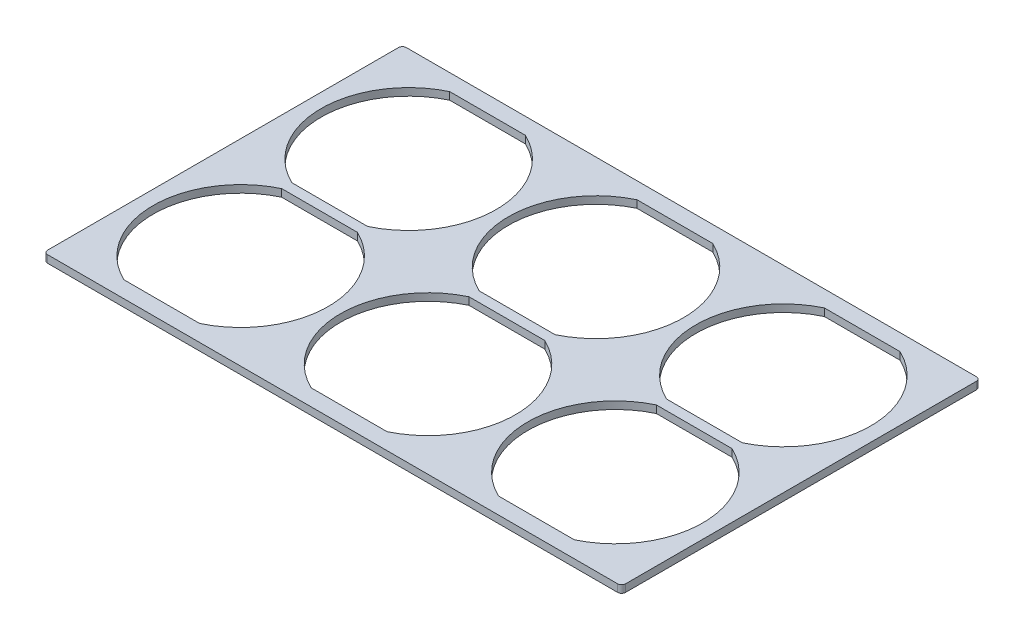
from build123d import *

# Parameters (mm, degrees)
SKETCH1_W             = 368.3
SKETCH1_H             = 228.6
BOSS_EXTRUDE1_DEPTH   = 4.7625
CUT_EXTRUDE1_DEPTH    = 217.791129676
SKETCH_PATTERN1_DEPTH = 4.7625
FILLET1_R             = 2.54


# Read off the part's stored shape, not the designer's step: Sketch-Pattern1
with BuildPart() as part:
    # Sketch1 → Boss-Extrude1 (new body)
    with BuildSketch(Plane(origin=(0, 0, 0), x_dir=(1, 0, 0), z_dir=(0, 1, 0))):
        Rectangle(SKETCH1_W, SKETCH1_H)
    extrude(amount=BOSS_EXTRUDE1_DEPTH)

    # Sketch3 → Cut-Extrude1 (cut, through all)
    with BuildSketch(Plane.XZ):
        with BuildLine():
            Line((143.533374481, -3.245454654), (95.226625519, -3.245454654))
            ThreePointArc((95.226625519, -3.245454654), (63.594954654, -53.5305), (95.226625519, -103.815545346))
            Line((95.226625519, -103.815545346), (143.533374481, -103.815545346))
            ThreePointArc((143.533374481, -103.815545346), (175.165045346, -53.5305), (143.533374481, -3.245454654))
        make_face()
    extrude(amount=-CUT_EXTRUDE1_DEPTH, mode=Mode.SUBTRACT)

    # Sketch-Pattern1 outline → Sketch-Pattern1 (cut)
    with BuildSketch(Plane(origin=(0, 0, 0), x_dir=(1, 0, 0), z_dir=(0, 1, 0))):
        with BuildLine():
            ThreePointArc((-24.153374481, 103.815545346), (-55.785045346, 53.5305), (-24.153374481, 3.245454654))
            Line((-24.153374481, 3.245454654), (24.153374481, 3.245454654))
            ThreePointArc((24.153374481, 3.245454654), (55.785045346, 53.5305), (24.153374481, 103.815545346))
            Line((24.153374481, 103.815545346), (-24.153374481, 103.815545346))
        make_face()
        with BuildLine():
            ThreePointArc((-143.533374481, 103.815545346), (-175.165045346, 53.5305), (-143.533374481, 3.245454654))
            Line((-143.533374481, 3.245454654), (-95.226625519, 3.245454654))
            ThreePointArc((-95.226625519, 3.245454654), (-63.594954654, 53.5305), (-95.226625519, 103.815545346))
            Line((-95.226625519, 103.815545346), (-143.533374481, 103.815545346))
        make_face()
        with BuildLine():
            ThreePointArc((95.226625519, -3.245454654), (63.594954654, -53.5305), (95.226625519, -103.815545346))
            Line((95.226625519, -103.815545346), (143.533374481, -103.815545346))
            ThreePointArc((143.533374481, -103.815545346), (175.165045346, -53.5305), (143.533374481, -3.245454654))
            Line((143.533374481, -3.245454654), (95.226625519, -3.245454654))
        make_face()
        with BuildLine():
            ThreePointArc((-24.153374481, -3.245454654), (-55.785045346, -53.5305), (-24.153374481, -103.815545346))
            Line((-24.153374481, -103.815545346), (24.153374481, -103.815545346))
            ThreePointArc((24.153374481, -103.815545346), (55.785045346, -53.5305), (24.153374481, -3.245454654))
            Line((24.153374481, -3.245454654), (-24.153374481, -3.245454654))
        make_face()
        with BuildLine():
            ThreePointArc((-143.533374481, -3.245454654), (-175.165045346, -53.5305), (-143.533374481, -103.815545346))
            Line((-143.533374481, -103.815545346), (-95.226625519, -103.815545346))
            ThreePointArc((-95.226625519, -103.815545346), (-63.594954654, -53.5305), (-95.226625519, -3.245454654))
            Line((-95.226625519, -3.245454654), (-143.533374481, -3.245454654))
        make_face()
    extrude(amount=SKETCH_PATTERN1_DEPTH, mode=Mode.SUBTRACT)

    # Fillet1
    fillet1_edges = [part.edges().sort_by_distance(p)[0] for p in [
        (184.15, 2.38125, 114.3),
        (-184.15, 2.38125, 114.3),
        (-184.15, 2.38125, -114.3),
        (184.15, 2.38125, -114.3),
    ]]
    fillet(fillet1_edges, radius=FILLET1_R)


solid = part.part
